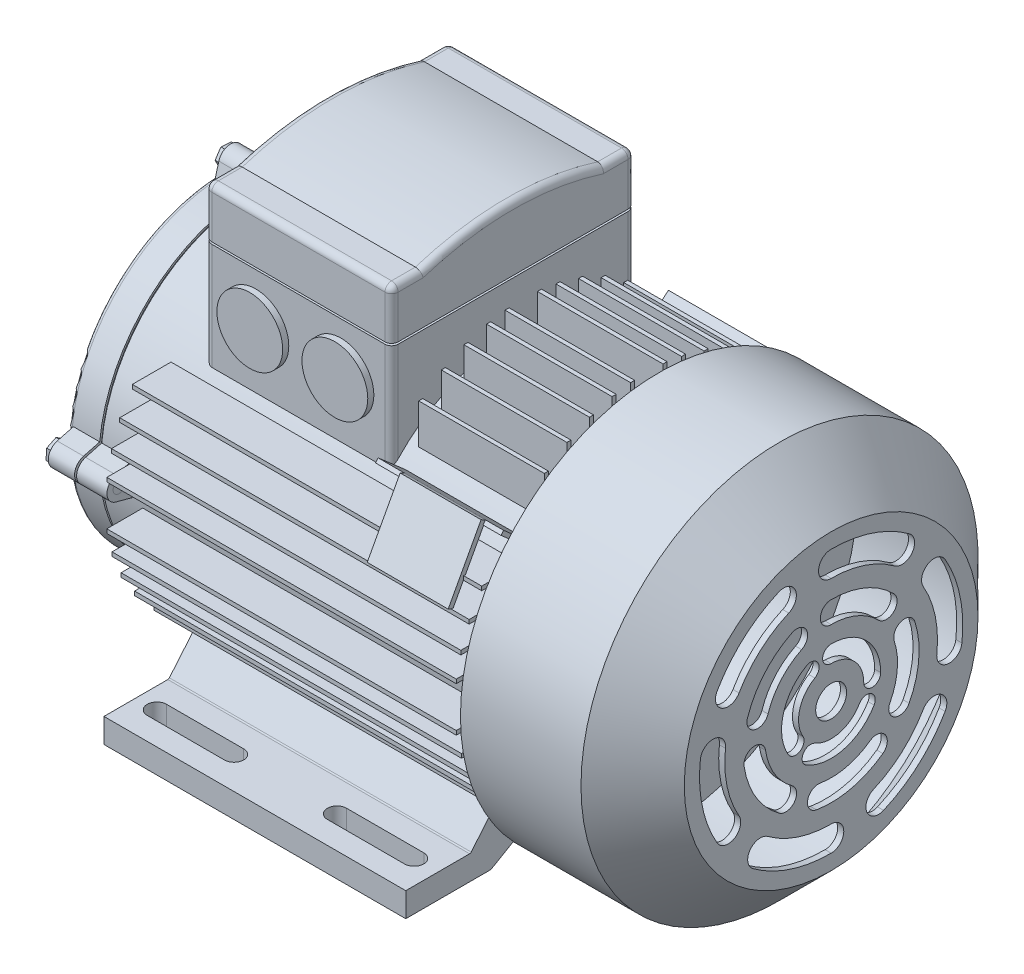
from build123d import *
from build123d.topology import SkipClean

# Parameters (mm, degrees)
BOSS_EXTRUDE1_START  = -148.999956
BOSS_EXTRUDE1_DEPTH  = 148.999956
BOSS_EXTRUDE2_DEPTH  = 46.000035
SKETCH4_R            = 16.250031
BOSS_EXTRUDE3_DEPTH  = 2.999994
SKETCH6_W            = 92.00007
SKETCH6_H            = 120.000014
SKETCH6_W_2          = 90.000074
SKETCH6_H_2          = 118.000018
CUT_EXTRUDE1_DEPTH   = 0.499999
SKETCH7_R            = 77.999971
SKETCH7_R_2          = 76.999973
CUT_EXTRUDE2_DEPTH   = 0.499999
BOSS_EXTRUDE4_START  = -14.99997
BOSS_EXTRUDE4_DEPTH  = 14.99997
BOSS_EXTRUDE5_DEPTH  = 12.999974
CUT_EXTRUDE3_REACH   = 342.208
SKETCH10_R           = 2.999994
CIRPATTERN1_COUNT    = 4
FILLET1_R            = 1.999996
BOSS_EXTRUDE6_DEPTH  = 172.499909
SKETCH12_R           = 67.999991
BOSS_EXTRUDE7_DEPTH  = 61.999749
BOSS_EXTRUDE8_DEPTH  = 61.999749
FILLET2_R            = 3.24993
FILLET3_R            = 3.24993
FILLET4_R            = 2
FILLET5_R            = 1
CUT_EXTRUDE4_DEPTH   = 391.330599421
LPATTERN1_COUNT      = 2
LPATTERN1_PITCH      = 88.9
LPATTERN1_COUNT_DIR2 = 2
LPATTERN1_PITCH_DIR2 = 165.1
SKETCH15_R           = 7.62
CUT_EXTRUDE5_DEPTH   = 28.194
SKETCH16_R           = 2.999994
BOSS_EXTRUDE9_DEPTH  = 31.499937
SKETCH17_R           = 2.999994
BOSS_EXTRUDE11_DEPTH = 2.499995
CIRPATTERN3_COUNT    = 4
SKETCH19_W           = 34.197808264
SKETCH19_H           = 39.956192705
BOSS_EXTRUDE12_DEPTH = 2.54


with BuildPart() as part:
    # Sketch1 → Revolve1 (revolve)
    with BuildSketch(Plane.XY, mode=Mode.PRIVATE) as revolve1_sk:
        Polygon((0, 19.99996), (0, 44.99991), (4.99999, 44.99991), (4.99999, 60.000007), (5.999988, 60.000007), (5.999988, 77.999971), (219.999814, 77.999971), (219.999814, 98.000058), (279.499822, 98.000058), (304.999898, 72.499982), (304.999898, 0), (301.999904, 0), (301.999904, 71.257343798), (278.257183798, 95.000064), (222.999808, 95.000064), (222.999808, 67.999991), (14.99997, 67.999991), (14.99997, 19.99996), align=None)
    revolve(revolve1_sk.sketch.rotate(Axis((-1000, 0, 0), (1, 0, 0)), 90), axis=Axis((-1000, 0, 0), (1, 0, 0)))

    # Sketch2 → Boss-Extrude1 (add)
    with BuildSketch(Plane.ZY.offset(-43.999912).offset(BOSS_EXTRUDE1_START)):
        with BuildLine():
            ThreePointArc((-45.387426851, -63.434824504), (-31.027008915, -71.56339982), (-15.277945972, -76.489083161))
            Line((-15.277945972, -76.489083161), (-56.000142, -100.000054))
            Line((-56.000142, -100.000054), (-98.000058, -100.000054))
            Line((-98.000058, -100.000054), (-98.000058, -88.000078))
            Line((-98.000058, -88.000078), (-66.000122, -88.000078))
            Line((-66.000122, -88.000078), (-45.387426851, -63.434824504))
        make_face()
        with BuildLine():
            Line((98.000058, -100.000054), (98.000058, -88.000078))
            Line((98.000058, -88.000078), (66.000122, -88.000078))
            Line((66.000122, -88.000078), (45.387426851, -63.434824504))
            ThreePointArc((45.387426851, -63.434824504), (31.027008915, -71.56339982), (15.277945972, -76.489083161))
            Line((15.277945972, -76.489083161), (56.000142, -100.000054))
            Line((56.000142, -100.000054), (98.000058, -100.000054))
        make_face()
    extrude(amount=BOSS_EXTRUDE1_DEPTH)

    # Sketch3 → Boss-Extrude2 (add, symmetric)
    with BuildSketch(Plane.ZY.offset(-102.00005)):
        with BuildLine():
            Line((-60.000007, 127.999998), (-60.000007, 49.839689365))
            ThreePointArc((-60.000007, 49.839689365), (0, 77.999971), (60.000007, 49.839689365))
            Line((60.000007, 49.839689365), (60.000007, 127.999998))
            Line((60.000007, 127.999998), (45.000037, 127.999998))
            ThreePointArc((45.000037, 127.999998), (0, 134.999984), (-45.000037, 127.999998))
            Line((-45.000037, 127.999998), (-60.000007, 127.999998))
        make_face()
    extrude(amount=BOSS_EXTRUDE2_DEPTH, both=True)

    # Sketch4 → Boss-Extrude3 (add)
    with BuildSketch(Plane.XY.offset(60.000007)):
        with Locations((81.000092, 78.000098)):
            Circle(SKETCH4_R)
        with Locations((123.000008, 78.000098)):
            Circle(SKETCH4_R)
    extrude(amount=BOSS_EXTRUDE3_DEPTH)

    # Sketch6 → Cut-Extrude1 (cut, symmetric)
    with BuildSketch(Plane(origin=(0, 103.000048, 0), x_dir=(1, 0, 0), z_dir=(0, 1, 0))):
        with Locations((102.00005, 0)):
            Rectangle(SKETCH6_W, SKETCH6_H)
        with Locations((102.00005, 0)):
            Rectangle(SKETCH6_W_2, SKETCH6_H_2, mode=Mode.SUBTRACT)
    extrude(amount=CUT_EXTRUDE1_DEPTH, both=True, mode=Mode.SUBTRACT)

    # Sketch7 → Cut-Extrude2 (cut, symmetric)
    with BuildSketch(Plane.ZY.offset(-21.999956)):
        Circle(SKETCH7_R)
        Circle(SKETCH7_R_2, mode=Mode.SUBTRACT)
    extrude(amount=CUT_EXTRUDE2_DEPTH, both=True, mode=Mode.SUBTRACT)

    # Sketch8 → Boss-Extrude4 (add)
    with BuildSketch(Plane.ZY.offset(-22.499955).offset(BOSS_EXTRUDE4_START)):
        with BuildLine():
            Line((-5.795543367, 85.552870165), (-7.927563028, 77.596064465))
            ThreePointArc((-7.927563028, 77.596064465), (0, 77.999971), (7.927563028, 77.596064465))
            Line((7.927563028, 77.596064465), (5.795543367, 85.552870165))
            ThreePointArc((5.795543367, 85.552870165), (0, 89.999947), (-5.795543367, 85.552870165))
        make_face()
    boss_extrude4 = extrude(amount=BOSS_EXTRUDE4_DEPTH)

    # Sketch9 → Boss-Extrude5 (add)
    with BuildSketch(Plane(origin=(21.499957, 0, 0), x_dir=(0, 0, -1), z_dir=(1, 0, 0))):
        with BuildLine():
            ThreePointArc((5.795543367, 85.552870165), (0, 89.999947), (-5.795543367, 85.552870165))
            Line((-5.795543367, 85.552870165), (-7.927563028, 77.596064465))
            ThreePointArc((-7.927563028, 77.596064465), (0, 77.999971), (7.927563028, 77.596064465))
            Line((7.927563028, 77.596064465), (5.795543367, 85.552870165))
        make_face()
    boss_extrude5 = extrude(amount=-BOSS_EXTRUDE5_DEPTH)

    # Cut-Extrude3: up to this face of the body (flat: up to its plane)
    cut_extrude3_end = Plane(part.part.faces().sort_by_distance((37.499925, 83.084844811, 0))[0])
    # Sketch10 → Cut-Extrude3 (cut, up to the picked face)
    with BuildSketch(Plane.ZY.offset(-8.499983), mode=Mode.PRIVATE) as cut_extrude3_sk1:
        with Locations((0, 83.999959)):
            Circle(SKETCH10_R)
    cut_extrude3_tool1 = split(extrude(cut_extrude3_sk1.sketch, amount=-CUT_EXTRUDE3_REACH, mode=Mode.PRIVATE), bisect_by=cut_extrude3_end, keep=Keep.BOTH, mode=Mode.PRIVATE)
    cut_extrude3 = cut_extrude3_tool1.solids().sort_by(Axis((8.499983, 83.999959, 0), (1, 0, 0)))[0]
    add(cut_extrude3, mode=Mode.SUBTRACT)

    # CirPattern1: Boss-Extrude4, Boss-Extrude5, Cut-Extrude3 ×4 about axis
    cirpattern1_axis = Axis((0, 0, 0), (1, 0, 0))
    add([boss_extrude4.rotate(cirpattern1_axis, i * 360 / CIRPATTERN1_COUNT) for i in range(1, CIRPATTERN1_COUNT)])
    add([boss_extrude5.rotate(cirpattern1_axis, i * 360 / CIRPATTERN1_COUNT) for i in range(1, CIRPATTERN1_COUNT)])
    add([cut_extrude3.rotate(cirpattern1_axis, i * 360 / CIRPATTERN1_COUNT) for i in range(1, CIRPATTERN1_COUNT)], mode=Mode.SUBTRACT)

    # Fillet1
    fillet1_edges = [part.edges().sort_by_distance(p)[0] for p in [
        (5.999988, 0, -77.999971),
    ]]
    fillet(fillet1_edges, radius=FILLET1_R)

    # Sketch11 → Boss-Extrude6 (add)
    with BuildSketch(Plane.ZY.offset(-214.999824)):
        with BuildLine():
            ThreePointArc((63.389826227, 45.450252), (64.091257389, 44.455665582), (64.777084911, 43.450256))
            Line((64.777084911, 43.450256), (82.492060911, 43.450256))
            Line((82.492060911, 43.450256), (82.492060911, 45.450252))
            Line((82.492060911, 45.450252), (63.389826227, 45.450252))
        make_face()
        with BuildLine():
            ThreePointArc((70.053511689, 34.30016), (70.532770699, 33.303509327), (70.997851246, 32.300164))
            Line((70.997851246, 32.300164), (88.712827246, 32.300164))
            Line((88.712827246, 32.300164), (88.712827246, 34.30016))
            Line((88.712827246, 34.30016), (70.053511689, 34.30016))
        make_face()
        with BuildLine():
            ThreePointArc((74.485366533, 23.150068), (74.788248694, 22.152050318), (75.077759226, 21.150072))
            Line((75.077759226, 21.150072), (92.792735226, 21.150072))
            Line((92.792735226, 21.150072), (92.792735226, 23.150068))
            Line((92.792735226, 23.150068), (74.485366533, 23.150068))
        make_face()
        with BuildLine():
            ThreePointArc((77.071369859, 11.999976), (77.22030604, 11.000900469), (77.356291767, 9.99998))
            Line((77.356291767, 9.99998), (95.071267767, 9.99998))
            Line((95.071267767, 9.99998), (95.071267767, 11.999976))
            Line((95.071267767, 11.999976), (77.071369859, 11.999976))
        make_face()
        with BuildLine():
            Line((95.071333859, -11.999976), (95.071333859, -9.99998))
            Line((95.071333859, -9.99998), (77.356291767, -9.99998))
            ThreePointArc((77.356291767, -9.99998), (77.22030604, -11.000900469), (77.071369859, -11.999976))
            Line((77.071369859, -11.999976), (95.071333859, -11.999976))
        make_face()
        with BuildLine():
            Line((92.485330533, -21.150072), (75.077759226, -21.150072))
            ThreePointArc((75.077759226, -21.150072), (74.788248694, -22.152050318), (74.485366533, -23.150068))
            Line((74.485366533, -23.150068), (92.485330533, -23.150068))
            Line((92.485330533, -23.150068), (92.485330533, -21.150072))
        make_face()
        with BuildLine():
            Line((88.053475689, -32.300164), (70.997851246, -32.300164))
            ThreePointArc((70.997851246, -32.300164), (70.532770699, -33.303509327), (70.053511689, -34.30016))
            Line((70.053511689, -34.30016), (88.053475689, -34.30016))
            Line((88.053475689, -34.30016), (88.053475689, -32.300164))
        make_face()
        with BuildLine():
            Line((81.389790227, -43.450256), (64.777084911, -43.450256))
            ThreePointArc((64.777084911, -43.450256), (64.091257389, -44.455665582), (63.389826227, -45.450252))
            Line((63.389826227, -45.450252), (81.389790227, -45.450252))
            Line((81.389790227, -45.450252), (81.389790227, -43.450256))
        make_face()
        with BuildLine():
            Line((71.66928983, -54.600348), (55.702760024, -54.600348))
            ThreePointArc((55.702760024, -54.600348), (54.695185227, -55.609641151), (53.66932583, -56.600344))
            Line((53.66932583, -56.600344), (71.66928983, -56.600344))
            Line((71.66928983, -56.600344), (71.66928983, -54.600348))
        make_face()
    boss_extrude6 = extrude(amount=BOSS_EXTRUDE6_DEPTH)

    # Sketch12 → Boss-Extrude7 (add)
    # profile 1 of 15: a face of its own
    with SkipClean():  # the faces are left unmerged after this step: merging them gives an invalid solid
        with BuildSketch(Plane(origin=(214.999824, 0, 0), x_dir=(0, 0, -1), z_dir=(1, 0, 0))):
            with BuildLine():
                Line((-71.66928983, -54.600348), (-71.66928983, -56.600344))
                Line((-71.66928983, -56.600344), (-53.66932583, -56.600344))
                ThreePointArc((-53.66932583, -56.600344), (-54.695185227, -55.609641151), (-55.702760024, -54.600348))
                Line((-55.702760024, -54.600348), (-71.66928983, -54.600348))
            make_face()
        # profile 2 of 15: a face of its own
        with BuildSketch(Plane(origin=(214.999824, 0, 0), x_dir=(0, 0, -1), z_dir=(1, 0, 0))):
            with BuildLine():
                ThreePointArc((-55.702760024, -54.600348), (-54.695185227, -55.609641151), (-53.66932583, -56.600344))
                ThreePointArc((-53.66932583, -56.600344), (73.677306569, -25.605662904), (-6.999986, 77.685234582))
                ThreePointArc((-6.999986, 77.685234582), (-8.000648532, 77.58856294), (-8.999982, 77.479002317))
                ThreePointArc((-8.999982, 77.479002317), (-12.588615759, 76.977413761), (-16.150082, 76.309700087))
                ThreePointArc((-16.150082, 76.309700087), (-17.151561241, 76.09086294), (-18.150078, 75.858883096))
                ThreePointArc((-18.150078, 75.858883096), (-22.767979033, 74.6030469), (-27.300174, 73.066380611))
                ThreePointArc((-27.300174, 73.066380611), (-28.302850817, 72.683864177), (-29.30017, 72.287588935))
                ThreePointArc((-29.30017, 72.287588935), (-33.947335892, 70.225165445), (-38.450266, 67.864368564))
                ThreePointArc((-38.450266, 67.864368564), (-39.454621608, 67.2854242), (-40.450262, 66.691617015))
                ThreePointArc((-40.450262, 66.691617015), (-45.14222287, 63.609552666), (-49.600358, 60.198006298))
                ThreePointArc((-49.600358, 60.198006298), (-50.607539191, 59.353790554), (-51.600354, 58.492725557))
                ThreePointArc((-51.600354, 58.492725557), (-57.863735762, 52.304718331), (-63.389826227, 45.450252))
                ThreePointArc((-63.389826227, 45.450252), (-64.091257389, 44.455665582), (-64.777084911, 43.450256))
                ThreePointArc((-64.777084911, 43.450256), (-67.570359693, 38.964624558), (-70.053511689, 34.30016))
                ThreePointArc((-70.053511689, 34.30016), (-70.532770699, 33.303509327), (-70.997851246, 32.300164))
                ThreePointArc((-70.997851246, 32.300164), (-72.885339596, 27.779898271), (-74.485366533, 23.150068))
                ThreePointArc((-74.485366533, 23.150068), (-74.788248694, 22.152050318), (-75.077759226, 21.150072))
                ThreePointArc((-75.077759226, 21.150072), (-76.212009779, 16.604970384), (-77.071369859, 11.999976))
                ThreePointArc((-77.071369859, 11.999976), (-77.22030604, 11.000900469), (-77.356291767, 9.99998))
                ThreePointArc((-77.356291767, 9.99998), (-77.999971, 0), (-77.356291767, -9.99998))
                ThreePointArc((-77.356291767, -9.99998), (-77.22030604, -11.000900469), (-77.071369859, -11.999976))
                ThreePointArc((-77.071369859, -11.999976), (-76.212009779, -16.604970384), (-75.077759226, -21.150072))
                ThreePointArc((-75.077759226, -21.150072), (-74.788248694, -22.152050318), (-74.485366533, -23.150068))
                ThreePointArc((-74.485366533, -23.150068), (-72.885339596, -27.779898271), (-70.997851246, -32.300164))
                ThreePointArc((-70.997851246, -32.300164), (-70.532770699, -33.303509327), (-70.053511689, -34.30016))
                ThreePointArc((-70.053511689, -34.30016), (-67.570359693, -38.964624558), (-64.777084911, -43.450256))
                ThreePointArc((-64.777084911, -43.450256), (-64.091257389, -44.455665582), (-63.389826227, -45.450252))
                ThreePointArc((-63.389826227, -45.450252), (-59.721789066, -50.172735492), (-55.702760024, -54.600348))
            make_face()
            with Locations(Location((0, 0, 0), (0, 0, 180))):
                Circle(SKETCH12_R, mode=Mode.SUBTRACT)
        # profile 3 of 15: a face of its own
        with BuildSketch(Plane(origin=(214.999824, 0, 0), x_dir=(0, 0, -1), z_dir=(1, 0, 0))):
            with BuildLine():
                ThreePointArc((-8.999982, 77.479002317), (-8.000648532, 77.58856294), (-6.999986, 77.685234582))
                Line((-6.999986, 77.685234582), (-6.999986, 95.685198582))
                Line((-6.999986, 95.685198582), (-8.999982, 95.685198582))
                Line((-8.999982, 95.685198582), (-8.999982, 77.479002317))
            make_face()
        # profile 4 of 15: a face of its own
        with BuildSketch(Plane(origin=(214.999824, 0, 0), x_dir=(0, 0, -1), z_dir=(1, 0, 0))):
            with BuildLine():
                Line((-81.389790227, -45.450252), (-63.389826227, -45.450252))
                ThreePointArc((-63.389826227, -45.450252), (-64.091257389, -44.455665582), (-64.777084911, -43.450256))
                Line((-64.777084911, -43.450256), (-81.389790227, -43.450256))
                Line((-81.389790227, -43.450256), (-81.389790227, -45.450252))
            make_face()
        # profile 5 of 15: a face of its own
        with BuildSketch(Plane(origin=(214.999824, 0, 0), x_dir=(0, 0, -1), z_dir=(1, 0, 0))):
            with BuildLine():
                ThreePointArc((-18.150078, 75.858883096), (-17.151561241, 76.09086294), (-16.150082, 76.309700087))
                Line((-16.150082, 76.309700087), (-16.150082, 94.309664087))
                Line((-16.150082, 94.309664087), (-18.150078, 94.309664087))
                Line((-18.150078, 94.309664087), (-18.150078, 75.858883096))
            make_face()
        # profile 6 of 15: a face of its own
        with BuildSketch(Plane(origin=(214.999824, 0, 0), x_dir=(0, 0, -1), z_dir=(1, 0, 0))):
            with BuildLine():
                Line((-88.053475689, -34.30016), (-70.053511689, -34.30016))
                ThreePointArc((-70.053511689, -34.30016), (-70.532770699, -33.303509327), (-70.997851246, -32.300164))
                Line((-70.997851246, -32.300164), (-88.053475689, -32.300164))
                Line((-88.053475689, -32.300164), (-88.053475689, -34.30016))
            make_face()
        # profile 7 of 15: a face of its own
        with BuildSketch(Plane(origin=(214.999824, 0, 0), x_dir=(0, 0, -1), z_dir=(1, 0, 0))):
            with BuildLine():
                ThreePointArc((-29.30017, 72.287588935), (-28.302850817, 72.683864177), (-27.300174, 73.066380611))
                Line((-27.300174, 73.066380611), (-27.300174, 91.066344611))
                Line((-27.300174, 91.066344611), (-29.30017, 91.066344611))
                Line((-29.30017, 91.066344611), (-29.30017, 72.287588935))
            make_face()
        # profile 8 of 15: a face of its own
        with BuildSketch(Plane(origin=(214.999824, 0, 0), x_dir=(0, 0, -1), z_dir=(1, 0, 0))):
            with BuildLine():
                Line((-92.485330533, -23.150068), (-74.485366533, -23.150068))
                ThreePointArc((-74.485366533, -23.150068), (-74.788248694, -22.152050318), (-75.077759226, -21.150072))
                Line((-75.077759226, -21.150072), (-92.485330533, -21.150072))
                Line((-92.485330533, -21.150072), (-92.485330533, -23.150068))
            make_face()
        # profile 9 of 15: a face of its own
        with BuildSketch(Plane(origin=(214.999824, 0, 0), x_dir=(0, 0, -1), z_dir=(1, 0, 0))):
            with BuildLine():
                ThreePointArc((-40.450262, 66.691617015), (-39.454621608, 67.2854242), (-38.450266, 67.864368564))
                Line((-38.450266, 67.864368564), (-38.450266, 85.864332564))
                Line((-38.450266, 85.864332564), (-40.450262, 85.864332564))
                Line((-40.450262, 85.864332564), (-40.450262, 66.691617015))
            make_face()
        # profile 10 of 15: a face of its own
        with BuildSketch(Plane(origin=(214.999824, 0, 0), x_dir=(0, 0, -1), z_dir=(1, 0, 0))):
            with BuildLine():
                Line((-95.071333859, -11.999976), (-77.071369859, -11.999976))
                ThreePointArc((-77.071369859, -11.999976), (-77.22030604, -11.000900469), (-77.356291767, -9.99998))
                Line((-77.356291767, -9.99998), (-95.071333859, -9.99998))
                Line((-95.071333859, -9.99998), (-95.071333859, -11.999976))
            make_face()
        # profile 11 of 15: a face of its own
        with BuildSketch(Plane(origin=(214.999824, 0, 0), x_dir=(0, 0, -1), z_dir=(1, 0, 0))):
            with BuildLine():
                ThreePointArc((-51.600354, 58.492725557), (-50.607539191, 59.353790554), (-49.600358, 60.198006298))
                Line((-49.600358, 60.198006298), (-49.600358, 78.197970298))
                Line((-49.600358, 78.197970298), (-51.600354, 78.197970298))
                Line((-51.600354, 78.197970298), (-51.600354, 58.492725557))
            make_face()
        # profile 12 of 15: a face of its own
        with BuildSketch(Plane(origin=(214.999824, 0, 0), x_dir=(0, 0, -1), z_dir=(1, 0, 0))):
            with BuildLine():
                Line((-95.071267767, 9.99998), (-77.356291767, 9.99998))
                ThreePointArc((-77.356291767, 9.99998), (-77.22030604, 11.000900469), (-77.071369859, 11.999976))
                Line((-77.071369859, 11.999976), (-95.071267767, 11.999976))
                Line((-95.071267767, 11.999976), (-95.071267767, 9.99998))
            make_face()
        # profile 13 of 15: a face of its own
        with BuildSketch(Plane(origin=(214.999824, 0, 0), x_dir=(0, 0, -1), z_dir=(1, 0, 0))):
            with BuildLine():
                ThreePointArc((-64.777084911, 43.450256), (-64.091257389, 44.455665582), (-63.389826227, 45.450252))
                Line((-63.389826227, 45.450252), (-82.492060911, 45.450252))
                Line((-82.492060911, 45.450252), (-82.492060911, 43.450256))
                Line((-82.492060911, 43.450256), (-64.777084911, 43.450256))
            make_face()
        # profile 14 of 15: a face of its own
        with BuildSketch(Plane(origin=(214.999824, 0, 0), x_dir=(0, 0, -1), z_dir=(1, 0, 0))):
            with BuildLine():
                Line((-92.792735226, 21.150072), (-75.077759226, 21.150072))
                ThreePointArc((-75.077759226, 21.150072), (-74.788248694, 22.152050318), (-74.485366533, 23.150068))
                Line((-74.485366533, 23.150068), (-92.792735226, 23.150068))
                Line((-92.792735226, 23.150068), (-92.792735226, 21.150072))
            make_face()
        # profile 15 of 15: a face of its own
        with BuildSketch(Plane(origin=(214.999824, 0, 0), x_dir=(0, 0, -1), z_dir=(1, 0, 0))):
            with BuildLine():
                ThreePointArc((-70.997851246, 32.300164), (-70.532770699, 33.303509327), (-70.053511689, 34.30016))
                Line((-70.053511689, 34.30016), (-88.712827246, 34.30016))
                Line((-88.712827246, 34.30016), (-88.712827246, 32.300164))
                Line((-88.712827246, 32.300164), (-70.997851246, 32.300164))
            make_face()
        boss_extrude7 = extrude(amount=-BOSS_EXTRUDE7_DEPTH)

    # Sketch13 → Boss-Extrude8 (add)
    with SkipClean():  # the faces are left unmerged after this step: merging them gives an invalid solid
        with BuildSketch(Plane(origin=(214.999824, 0, 0), x_dir=(0, 0, -1), z_dir=(1, 0, 0))):
            with BuildLine():
                ThreePointArc((-59.41571374, 50.534824), (-58.762949303, 51.29240943), (-58.100525896, 52.041563837))
                Line((-58.100525896, 52.041563837), (-71.661244081, 63.878186088))
                Line((-71.661244081, 63.878186088), (-72.976431925, 62.371446252))
                Line((-72.976431925, 62.371446252), (-59.41571374, 50.534824))
            make_face()
        boss_extrude8 = extrude(amount=-BOSS_EXTRUDE8_DEPTH)

    # Mirror1: Boss-Extrude6, Boss-Extrude7, Boss-Extrude8 across plane
    with SkipClean():  # the faces are left unmerged after this step: merging them gives an invalid solid
        add(boss_extrude6.mirror(Plane.XY))
        add(boss_extrude7.mirror(Plane.XY))
        add(boss_extrude8.mirror(Plane.XY))

    # Fillet2
    fillet2_edges = [part.edges().sort_by_distance(p)[0] for p in [
        (148.000085, 76.169869183, 60.000007),
        (148.000085, 76.169869183, -60.000007),
        (56.000015, 76.169869183, -60.000007),
        (56.000015, 76.169869183, 60.000007),
        (147.000087, 103.000048, 59.000009),
        (57.000013, 103.000048, 59.000009),
        (57.000013, 103.000048, -59.000009),
        (147.000087, 103.000048, -59.000009),
        (148.000085, 115.7500225, -60.000007),
        (56.000015, 115.7500225, 60.000007),
        (56.000015, 115.7500225, -60.000007),
        (148.000085, 115.7500225, 60.000007),
    ]]
    fillet(fillet2_edges, radius=FILLET2_R)

    # Fillet3
    fillet3_edges = [part.edges().sort_by_distance(p)[0] for p in [
        (102.00005, 127.999998, -60.000007),
        (56.951897459, 127.999998, -59.048124541),
        (147.048202541, 127.999998, -59.048124541),
        (102.00005, 127.999998, 60.000007),
        (56.951897459, 127.999998, 59.048124541),
        (147.048202541, 127.999998, 59.048124541),
        (148.000085, 127.999998, -50.875057),
        (56.000015, 127.999998, 50.875057),
        (56.000015, 134.999984, 0),
        (56.000015, 127.999998, -50.875057),
        (148.000085, 134.999984, 0),
        (148.000085, 127.999998, 50.875057),
    ]]
    fillet(fillet3_edges, radius=FILLET3_R)

    # Fillet4
    fillet4_edges = [part.edges().sort_by_distance(p)[0] for p in [
        (118.49989, -100.000054, -56.000142),
        (118.49989, -100.000054, 56.000142),
    ]]
    fillet(fillet4_edges, radius=FILLET4_R)

    # Fillet5
    fillet5_edges = [part.edges().sort_by_distance(p)[0] for p in [
        (118.49989, -88.000078, -66.000122),
        (118.49989, -88.000078, 66.000122),
    ]]
    fillet(fillet5_edges, radius=FILLET5_R)

    # Sketch14 → Cut-Extrude4 (cut, through all)
    with SkipClean():  # the faces are left unmerged after this step: merging them gives an invalid solid
        with BuildSketch(Plane(origin=(0, -88.000078, 0), x_dir=(1, 0, 0), z_dir=(0, 1, 0))):
            with BuildLine():
                Line((54.253384, -77.362558), (92.353384, -77.362558))
                ThreePointArc((92.353384, -77.362558), (97.115884, -82.125058), (92.353384, -86.887558))
                Line((92.353384, -86.887558), (54.253384, -86.887558))
                ThreePointArc((54.253384, -86.887558), (49.490884, -82.125058), (54.253384, -77.362558))
            make_face()
        cut_extrude4 = extrude(amount=-CUT_EXTRUDE4_DEPTH, mode=Mode.SUBTRACT)

    # LPattern1: Cut-Extrude4 2 × 2
    with SkipClean():  # the faces are left unmerged after this step: merging them gives an invalid solid
        with Locations(*[(i * LPATTERN1_PITCH, 0, -j * LPATTERN1_PITCH_DIR2) for i in range(LPATTERN1_COUNT) for j in range(LPATTERN1_COUNT_DIR2) if (i, j) != (0, 0)]):
            add(cut_extrude4, mode=Mode.SUBTRACT)

    # Sketch15 → Cut-Extrude5 (cut)
    with SkipClean():  # the faces are left unmerged after this step: merging them gives an invalid solid
        with BuildSketch(Plane(origin=(304.999898, 0, 0), x_dir=(0, 0, -1), z_dir=(1, 0, 0))):
            Circle(SKETCH15_R)
            with BuildLine():
                ThreePointArc((24.472931371, 0), (17.304975728, 17.304975728), (0, 24.472931371))
                ThreePointArc((0, 24.472931371), (-4.188683714, 20.284247656), (0, 16.095563942))
                ThreePointArc((0, 16.095563942), (11.38128241, 11.38128241), (16.095563942, 0))
                ThreePointArc((16.095563942, 0), (20.284247656, -4.188683714), (24.472931371, 0))
            make_face()
            with BuildLine():
                ThreePointArc((-12.236465685, -21.194180272), (6.334060728, -23.639036456), (21.194180272, -12.236465685))
                ThreePointArc((21.194180272, -12.236465685), (19.661015624, -6.514617323), (13.939167262, -8.047781971))
                ThreePointArc((13.939167262, -8.047781971), (4.16583849, -15.5471209), (-8.047781971, -13.939167262))
                ThreePointArc((-8.047781971, -13.939167262), (-13.769630333, -15.47233191), (-12.236465685, -21.194180272))
            make_face()
            with BuildLine():
                ThreePointArc((-12.236465685, 21.194180272), (-23.639036456, 6.334060728), (-21.194180272, -12.236465685))
                ThreePointArc((-21.194180272, -12.236465685), (-15.47233191, -13.769630333), (-13.939167262, -8.047781971))
                ThreePointArc((-13.939167262, -8.047781971), (-15.5471209, 4.16583849), (-8.047781971, 13.939167262))
                ThreePointArc((-8.047781971, 13.939167262), (-6.514617323, 19.661015624), (-12.236465685, 21.194180272))
            make_face()
            with BuildLine():
                ThreePointArc((31.031134225, 30.3873487), (16.830695928, 40.038105936), (0, 43.431811525))
                ThreePointArc((0, 43.431811525), (-5.331811525, 38.1), (0, 32.768188475))
                ThreePointArc((0, 32.768188475), (12.698328644, 30.207724601), (23.412195329, 22.926475652))
                ThreePointArc((23.412195329, 22.926475652), (30.952101301, 22.847442728), (31.031134225, 30.3873487))
            make_face()
            with BuildLine():
                ThreePointArc((38.489233825, -20.122155251), (43.279472619, -3.63448788), (41.306107365, 13.421167858))
                ThreePointArc((41.306107365, 13.421167858), (34.587632899, 16.84440158), (31.164399176, 10.125927114))
                ThreePointArc((31.164399176, 10.125927114), (32.653252676, -2.74212794), (29.039140297, -15.18165033))
                ThreePointArc((29.039140297, -15.18165033), (31.2939346, -22.376949554), (38.489233825, -20.122155251))
            make_face()
            with BuildLine():
                ThreePointArc((-7.243479521, -42.823524572), (9.917489166, -42.284342977), (25.528578295, -35.13707362))
                ThreePointArc((25.528578295, -35.13707362), (26.708144247, -27.689587303), (19.26065793, -26.510021351))
                ThreePointArc((19.26065793, -26.510021351), (7.482491353, -31.902452869), (-5.465019621, -32.309251562))
                ThreePointArc((-5.465019621, -32.309251562), (-11.611386076, -36.677158117), (-7.243479521, -42.823524572))
            make_face()
            with BuildLine():
                ThreePointArc((-42.965950365, -6.344238453), (-37.150127232, -22.498673272), (-25.528578295, -35.13707362))
                ThreePointArc((-25.528578295, -35.13707362), (-18.081091978, -33.957507668), (-19.26065793, -26.510021351))
                ThreePointArc((-19.26065793, -26.510021351), (-28.028818699, -16.974672258), (-32.416708172, -4.786565286))
                ThreePointArc((-32.416708172, -4.786565286), (-38.470165852, -0.290780773), (-42.965950365, -6.344238453))
            make_face()
            with BuildLine():
                ThreePointArc((-19.310938164, 38.902569575), (-32.877530481, 28.379398193), (-41.306107365, 13.421167858))
                ThreePointArc((-41.306107365, 13.421167858), (-37.882873643, 6.702693391), (-31.164399176, 10.125927114))
                ThreePointArc((-31.164399176, 10.125927114), (-24.805253973, 21.411528466), (-14.569607833, 29.350991526))
                ThreePointArc((-14.569607833, 29.350991526), (-12.164483973, 36.497445716), (-19.310938164, 38.902569575))
            make_face()
            with BuildLine():
                ThreePointArc((38.678470477, 52.22080856), (20.36508071, 61.711428543), (0, 64.98489767))
                ThreePointArc((0, 64.98489767), (-6.236637985, 58.748259685), (0, 52.5116217))
                ThreePointArc((0, 52.5116217), (16.456183705, 49.866466001), (31.254480387, 42.197486529))
                ThreePointArc((31.254480387, 42.197486529), (39.978136448, 43.497152499), (38.678470477, 52.22080856))
            make_face()
            with BuildLine():
                ThreePointArc((64.563782058, -7.386133733), (63.626205177, 13.219037027), (56.278572245, 32.492448835))
                ThreePointArc((56.278572245, 32.492448835), (47.759166323, 34.775216772), (45.476398386, 26.25581085))
                ThreePointArc((45.476398386, 26.25581085), (51.413718207, 10.681759862), (52.171335503, -5.968430733))
                ThreePointArc((52.171335503, -5.968430733), (57.658707281, -12.87350551), (64.563782058, -7.386133733))
            make_face()
            with BuildLine():
                ThreePointArc((25.885311581, -59.606942293), (43.261124467, -48.492391517), (56.278572245, -32.492448835))
                ThreePointArc((56.278572245, -32.492448835), (53.995804308, -23.973042913), (45.476398386, -26.25581085))
                ThreePointArc((45.476398386, -26.25581085), (34.957534501, -39.184706139), (20.916855116, -48.165917261))
                ThreePointArc((20.916855116, -48.165917261), (17.680570833, -56.370658009), (25.885311581, -59.606942293))
            make_face()
            with BuildLine():
                ThreePointArc((-38.678470477, -52.22080856), (-20.36508071, -61.711428543), (0, -64.98489767))
                ThreePointArc((0, -64.98489767), (6.236637985, -58.748259685), (0, -52.5116217))
                ThreePointArc((0, -52.5116217), (-16.456183705, -49.866466001), (-31.254480387, -42.197486529))
                ThreePointArc((-31.254480387, -42.197486529), (-39.978136448, -43.497152499), (-38.678470477, -52.22080856))
            make_face()
            with BuildLine():
                ThreePointArc((-64.563782058, 7.386133733), (-63.626205177, -13.219037027), (-56.278572245, -32.492448835))
                ThreePointArc((-56.278572245, -32.492448835), (-47.759166323, -34.775216772), (-45.476398386, -26.25581085))
                ThreePointArc((-45.476398386, -26.25581085), (-51.413718207, -10.681759862), (-52.171335503, 5.968430733))
                ThreePointArc((-52.171335503, 5.968430733), (-57.658707281, 12.87350551), (-64.563782058, 7.386133733))
            make_face()
            with BuildLine():
                ThreePointArc((-25.885311581, 59.606942293), (-43.261124467, 48.492391517), (-56.278572245, 32.492448835))
                ThreePointArc((-56.278572245, 32.492448835), (-53.995804308, 23.973042913), (-45.476398386, 26.25581085))
                ThreePointArc((-45.476398386, 26.25581085), (-34.957534501, 39.184706139), (-20.916855116, 48.165917261))
                ThreePointArc((-20.916855116, 48.165917261), (-17.680570833, 56.370658009), (-25.885311581, 59.606942293))
            make_face()
        extrude(amount=-CUT_EXTRUDE5_DEPTH, mode=Mode.SUBTRACT)


with BuildPart() as body_2:
    # Sketch16 → Boss-Extrude9 (new body)
    with BuildSketch(Plane.ZY.offset(-5.999988)):
        with Locations((0, 83.999959)):
            Circle(SKETCH16_R)
    extrude(amount=-BOSS_EXTRUDE9_DEPTH)


with BuildPart() as body_3:
    # Sketch17 → Boss-Extrude11 (new body)
    with BuildSketch(Plane.ZY.offset(-5.999988)):
        Polygon((2.85890458, 79.737248837), (5.12106758, 84.344487911), (2.262163001, 88.607198075), (-2.85890458, 88.262669163), (-5.12106758, 83.655430089), (-2.262163001, 79.392719925), align=None)
        with Locations((0, 83.999959)):
            Circle(SKETCH17_R, mode=Mode.SUBTRACT)
    extrude(amount=-BOSS_EXTRUDE11_DEPTH)


with BuildPart() as cirpattern3_1:
    # CirPattern3: pattern copy
    add(body_3.part.rotate(Axis((0, 0, 0), (1, 0, 0)), 1 * 360 / CIRPATTERN3_COUNT))


with BuildPart() as cirpattern3_2:
    # CirPattern3: pattern copy
    add(body_3.part.rotate(Axis((0, 0, 0), (1, 0, 0)), 2 * 360 / CIRPATTERN3_COUNT))


with BuildPart() as cirpattern3_3:
    # CirPattern3: pattern copy
    add(body_3.part.rotate(Axis((0, 0, 0), (1, 0, 0)), 3 * 360 / CIRPATTERN3_COUNT))


with BuildPart() as cirpattern3_4:
    # CirPattern3: pattern copy
    add(body_2.part.rotate(Axis((0, 0, 0), (1, 0, 0)), 1 * 360 / CIRPATTERN3_COUNT))


with BuildPart() as cirpattern3_5:
    # CirPattern3: pattern copy
    add(body_2.part.rotate(Axis((0, 0, 0), (1, 0, 0)), 2 * 360 / CIRPATTERN3_COUNT))


with BuildPart() as cirpattern3_6:
    # CirPattern3: pattern copy
    add(body_2.part.rotate(Axis((0, 0, 0), (1, 0, 0)), 3 * 360 / CIRPATTERN3_COUNT))


with BuildPart() as body_10:
    # Sketch19 → Boss-Extrude12 (new body)
    with BuildSketch(Plane(origin=(0, 44.380876135, 82.189452632), x_dir=(0, -0.8799117905685993, 0.4751370758195593), z_dir=(0, -0.4751370758195593, -0.8799117905685993))):
        with Locations((-5.059351005, -186.09939602)):
            Rectangle(SKETCH19_W, SKETCH19_H)
    extrude(amount=-BOSS_EXTRUDE12_DEPTH)


solid = Compound([part.part, body_2.part, body_3.part, cirpattern3_1.part, cirpattern3_2.part, cirpattern3_3.part, cirpattern3_4.part, cirpattern3_5.part, cirpattern3_6.part, body_10.part])
